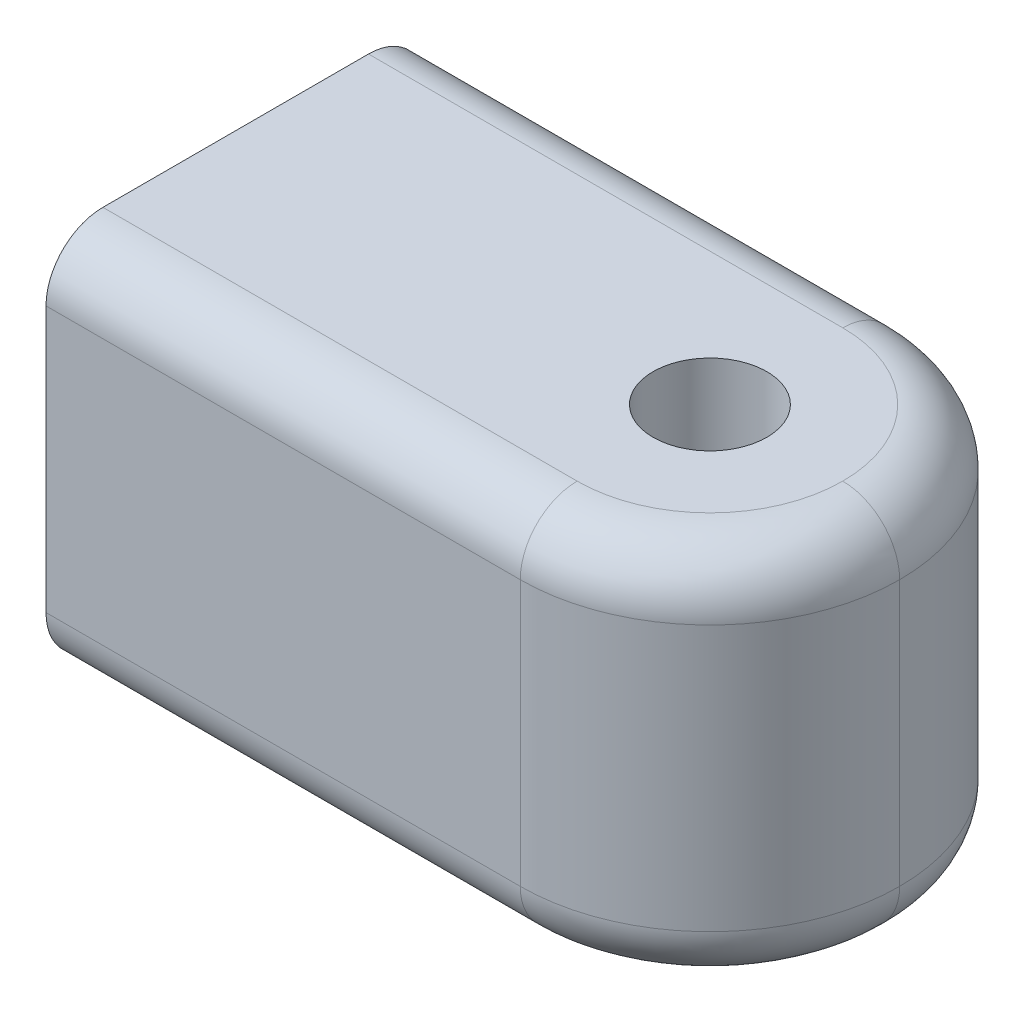
from build123d import *

# Parameters (mm, degrees)
SKETCH1_W                = 20
SKETCH1_H                = 20
SKETCH1_R                = 5.3
BOSS_EXTRUDE1_DEPTH      = 10
SKETCH2_W                = 20
SKETCH2_H                = 20
BOSS_EXTRUDE2_DEPTH      = 5
BOSS_EXTRUDE6_DEPTH      = 20
BOSS_EXTRUDE6_DEPTH_BACK = 5
SKETCH9_W                = 20
SKETCH9_H                = 20
F_6_0_6_DIAMETER_HOLE3_D = 6
FILLET3_R                = 10
FILLET6_R                = 3


with BuildPart() as part:
    # Sketch1 → Boss-Extrude1 (new body)
    with BuildSketch(Plane(origin=(0, 0, 0), x_dir=(0, 0, -1), z_dir=(1, 0, 0))):
        Rectangle(SKETCH1_W, SKETCH1_H)
        Circle(SKETCH1_R, mode=Mode.SUBTRACT)
    extrude(amount=BOSS_EXTRUDE1_DEPTH)

    # Sketch2 → Boss-Extrude2 (add)
    with BuildSketch(Plane(origin=(10, 0, 0), x_dir=(0, 0, -1), z_dir=(1, 0, 0))):
        Rectangle(SKETCH2_W, SKETCH2_H)
    extrude(amount=BOSS_EXTRUDE2_DEPTH)

    # Sketch9 → Boss-Extrude6 (add, two sides: drawn at the far end of the back side and taken through both)
    with BuildSketch(Plane(origin=(15, 0, 0), x_dir=(0, 0, -1), z_dir=(1, 0, 0)).offset(-BOSS_EXTRUDE6_DEPTH_BACK)):
        Rectangle(SKETCH9_W, SKETCH9_H)
    extrude(amount=BOSS_EXTRUDE6_DEPTH + BOSS_EXTRUDE6_DEPTH_BACK)

    # Ø6.0 (6) Diameter Hole3 (through all)
    with Locations(Plane(origin=(25, 10, 0), x_dir=(0, 0, 1), z_dir=(0, 1, 0))):
        with Locations((0, 0)):
            Hole(F_6_0_6_DIAMETER_HOLE3_D / 2)

    # Fillet3
    fillet3_edges = [part.edges().sort_by_distance(p)[0] for p in [
        (35, 0, -10),
        (35, 0, 10),
    ]]
    fillet(fillet3_edges, radius=FILLET3_R - 0.0001)  # a hair under: the kernel refuses the full size

    # Fillet6
    fillet6_edges = [part.edges().sort_by_distance(p)[0] for p in [
        (12.50005, -10, -10),
        (12.50005, -10, 10),
        (32.071097101, -10, -7.071097101),
        (32.071097101, -10, 7.071097101),
        (12.50005, 10, 10),
        (12.50005, 10, -10),
        (32.071097101, 10, -7.071097101),
        (32.071097101, 10, 7.071097101),
    ]]
    fillet(fillet6_edges, radius=FILLET6_R)


solid = part.part
